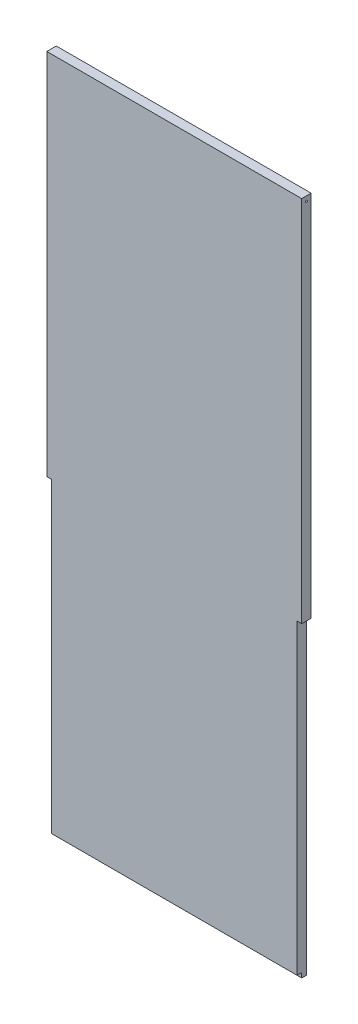
from build123d import *

# Parameters (mm, degrees)
BOSS_EXTRUDE1_DEPTH = 12.7
SKETCH2_W           = 330.2
SKETCH2_H           = 6.35
CUT_EXTRUDE1_DEPTH  = 6.35
SKETCH3_R           = 1.27
CUT_EXTRUDE2_DEPTH  = 977.66220363


with BuildPart() as part:
    # Sketch1 → Boss-Extrude1 (new body)
    with BuildSketch(Plane.XY):
        Polygon((0, 419.1), (-6.35, 419.1), (-6.35, 914.4), (336.55, 914.4), (336.55, 419.1), (330.2, 419.1), (330.2, 0), (0, 0), align=None)
    extrude(amount=BOSS_EXTRUDE1_DEPTH)

    # Sketch2 → Cut-Extrude1 (cut)
    with BuildSketch(Plane.XY.offset(12.7)):
        with Locations((165.1, 3.175)):
            Rectangle(SKETCH2_W, SKETCH2_H)
    extrude(amount=-CUT_EXTRUDE1_DEPTH, mode=Mode.SUBTRACT)

    # Sketch3 → Cut-Extrude2 (cut, through all)
    with BuildSketch(Plane.ZY.offset(6.35)):
        with Locations((6.35, 908.05)):
            Circle(SKETCH3_R)
    extrude(amount=-CUT_EXTRUDE2_DEPTH, mode=Mode.SUBTRACT)


solid = part.part
